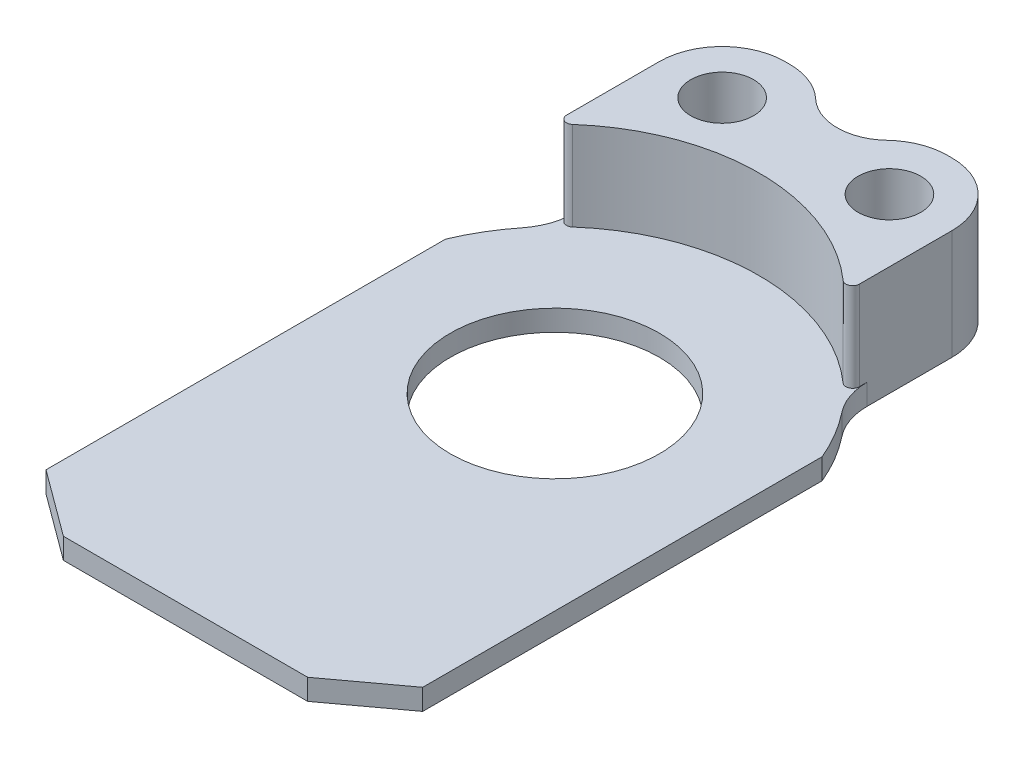
from build123d import *

# Parameters (mm, degrees)
SKETCH1_R           = 7.9375
BOSS_EXTRUDE1_DEPTH = 1.5875
SKETCH2_R           = 2.38125
BOSS_EXTRUDE2_DEPTH = 8.334375
CUT_EXTRUDE1_START  = -6.746875
CUT_EXTRUDE1_DEPTH  = 6.746875


with BuildPart() as part:
    # Sketch1 → Boss-Extrude1 (new body)
    with BuildSketch(Plane(origin=(0, 0, 0), x_dir=(1, 0, 0), z_dir=(0, 1, 0))):
        with BuildLine():
            Line((-14.3002, -24.3332), (-9.271, -28.0416))
            Line((-9.271, -28.0416), (9.271, -28.0416))
            Line((9.271, -28.0416), (14.3002, -24.3332))
            Line((14.3002, -24.3332), (14.3002, 5.9944))
            ThreePointArc((14.3002, 5.9944), (0, 15.505758653), (-14.3002, 5.9944))
            Line((-14.3002, 5.9944), (-14.3002, -24.3332))
        make_face()
        Circle(SKETCH1_R, mode=Mode.SUBTRACT)
    extrude(amount=BOSS_EXTRUDE1_DEPTH)

    # Sketch2 → Boss-Extrude2 (add)
    with BuildSketch(Plane.XZ):
        with BuildLine():
            Line((-11.1125, -12.601058837), (-11.1125, -19.05))
            ThreePointArc((-11.1125, -19.05), (-9.717596045, -22.417596045), (-6.35, -23.8125))
            Line((-6.35, -23.8125), (-5.983425441, -23.8125))
            ThreePointArc((-5.983425441, -23.8125), (-4.22646321, -23.476566386), (-2.717363519, -22.516157205))
            ThreePointArc((-2.717363519, -22.516157205), (0, -21.4376), (2.717363519, -22.516157205))
            ThreePointArc((2.717363519, -22.516157205), (4.22646321, -23.476566386), (5.983425441, -23.8125))
            Line((5.983425441, -23.8125), (6.35, -23.8125))
            ThreePointArc((6.35, -23.8125), (9.717596045, -22.417596045), (11.1125, -19.05))
            Line((11.1125, -19.05), (11.1125, -12.601058837))
            ThreePointArc((11.1125, -12.601058837), (11.377973728, -11.033206497), (12.144798566, -9.640146223))
            ThreePointArc((12.144798566, -9.640146223), (0, -15.505758653), (-12.144798566, -9.640146223))
            ThreePointArc((-12.144798566, -9.640146223), (-11.377973728, -11.033206497), (-11.1125, -12.601058837))
        make_face()
        with Locations((-6.35, -19.05)):
            Circle(SKETCH2_R, mode=Mode.SUBTRACT)
        with Locations((6.35, -19.05)):
            Circle(SKETCH2_R, mode=Mode.SUBTRACT)
    extrude(amount=-BOSS_EXTRUDE2_DEPTH)

    # Sketch3 → Cut-Extrude1 (cut)
    with BuildSketch(Plane(origin=(0, 8.334375, 0), x_dir=(1, 0, 0), z_dir=(0, 1, 0)).offset(CUT_EXTRUDE1_START)):
        with BuildLine():
            Line((-11.1125, 19.05), (-11.1125, 11.999376898))
            ThreePointArc((-11.1125, 11.999376898), (-10.813271374, 11.536258648), (-10.268096404, 11.618724011))
            ThreePointArc((-10.268096404, 11.618724011), (0, 15.505758653), (10.268096404, 11.618724011))
            ThreePointArc((10.268096404, 11.618724011), (10.813271374, 11.536258648), (11.1125, 11.999376898))
            Line((11.1125, 11.999376898), (11.1125, 19.05))
            Line((11.1125, 19.05), (16.416178114, 6.350325815))
            Line((16.416178114, 6.350325815), (-16.620971452, 6.890442702))
            Line((-16.620971452, 6.890442702), (-11.1125, 19.05))
        make_face()
    extrude(amount=CUT_EXTRUDE1_DEPTH, mode=Mode.SUBTRACT)


solid = part.part
